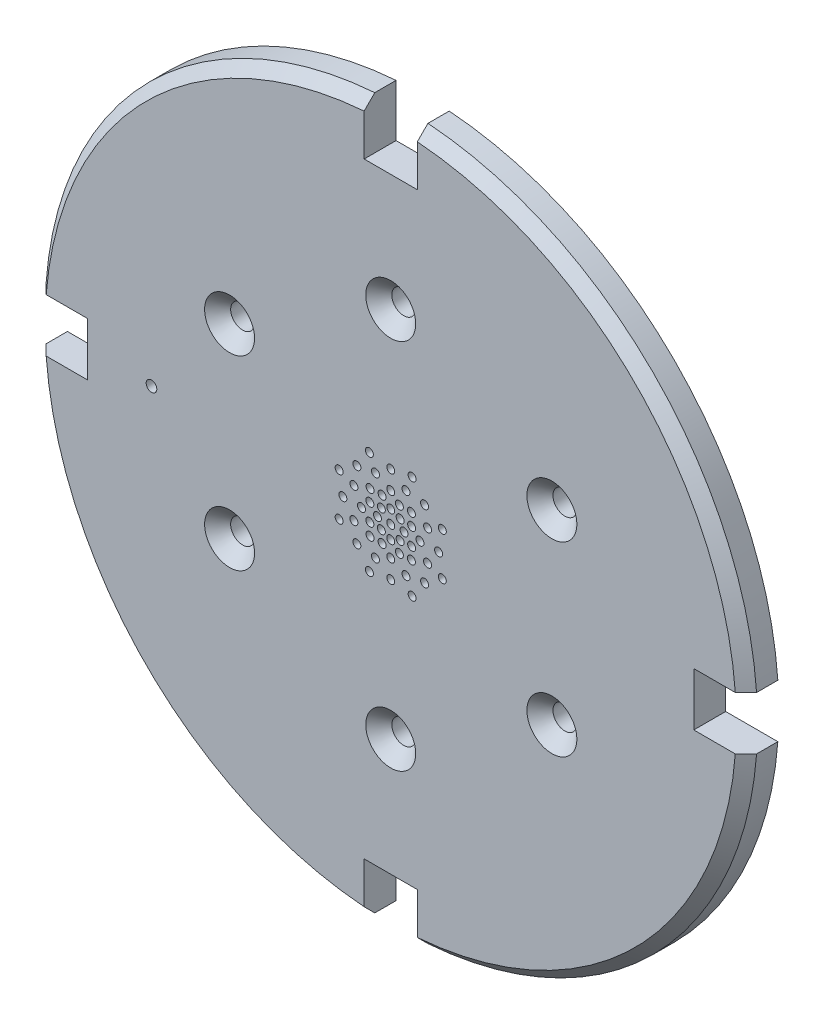
from build123d import *

# Parameters (mm, degrees)
SZKIC1_R                                             = 67
DODANIE_WYCI_GNI_CIE1_DEPTH                          = 6
SFAZOWANIE1_SIZE                                     = 2
OTWORY_USTALAJ_CE_1_5MM1_D                           = 1.5
OTWORY_USTALAJ_CE_1_5MM1_DEPTH                       = 6
OTWORY_USTALAJ_CE_1_5MM1_TIP                         = 0.450645464
OTWORY_USTALAJ_CE_1_5MM2_AT_2_COUNT                  = 2
OTWORY_USTALAJ_CE_1_5MM2_AT_2_PITCH                  = 2.163344618
OTWORY_USTALAJ_CE_1_5MM2_AT_3_COUNT                  = 2
OTWORY_USTALAJ_CE_1_5MM2_AT_3_PITCH                  = 3
OTWORY_USTALAJ_CE_1_5MM2_AT_4_COUNT                  = 2
OTWORY_USTALAJ_CE_1_5MM2_AT_4_PITCH                  = 5.277737918
OTWORY_USTALAJ_CE_1_5MM2_AT_5_COUNT                  = 2
OTWORY_USTALAJ_CE_1_5MM2_AT_5_PITCH                  = 6.5
OTWORY_USTALAJ_CE_1_5MM2_AT_6_COUNT                  = 2
OTWORY_USTALAJ_CE_1_5MM2_AT_6_PITCH                  = 8.245988391
SZYK_KO_OWY1_COUNT                                   = 8
WYTNIJ_WYCI_GNI_CIE1_REACH                           = 96.942
SZKIC7_R                                             = 2.05
SZYK_KO_OWY2_COUNT                                   = 6
SZKIC8_R                                             = 1
WYTNIJ_WYCI_GNI_CIE2_DEPTH                           = 20
SZKIC9_W                                             = 10
SZKIC9_H                                             = 10
WYTNIJ_WYCI_GNI_CIE3_DEPTH                           = 10
SZYK_KO_OWY3_COUNT                                   = 4
POG_BIENIE_STO_KOWE_POD_M4_WKR_T_DO_CZ_C_D           = 4.5
POG_BIENIE_STO_KOWE_POD_M4_WKR_T_DO_CZ_C_CSINK_D     = 9.4
POG_BIENIE_STO_KOWE_POD_M4_WKR_T_DO_CZ_C_CSINK_ANGLE = 90
SZYK_KO_OWY4_COUNT                                   = 6


with BuildPart() as part:
    # Szkic1 → Dodanie-wyciągnięcie1 (new body)
    with BuildSketch(Plane.XY):
        Circle(SZKIC1_R)
    extrude(amount=DODANIE_WYCI_GNI_CIE1_DEPTH)

    # Sfazowanie1
    sfazowanie1_edges = [part.edges().sort_by_distance(p)[0] for p in [
        (-67, 0, 6),
    ]]
    chamfer(sfazowanie1_edges, length=SFAZOWANIE1_SIZE)

    # Otwory ustalające Ø1.5mm1
    with Locations(Plane.XY.offset(6)):
        with Locations((0, 0)):
            Hole(OTWORY_USTALAJ_CE_1_5MM1_D / 2, depth=OTWORY_USTALAJ_CE_1_5MM1_DEPTH)
            with Locations((0, 0, -(OTWORY_USTALAJ_CE_1_5MM1_DEPTH + OTWORY_USTALAJ_CE_1_5MM1_TIP / 2))):  # 118° drill point
                Cone(0, OTWORY_USTALAJ_CE_1_5MM1_D / 2, OTWORY_USTALAJ_CE_1_5MM1_TIP, mode=Mode.SUBTRACT)

    # Szkic6 → Otwory ustalające Ø1.5mm2 (revolve, cut)
    with BuildSketch(Plane(origin=(0, 2.5, 6), x_dir=(0, -1, 0), z_dir=(1, 0, 0))):
        Polygon((0, 0), (0, 6.450645464), (0.75, 6), (0.75, 0), align=None)
    otwory_ustalaj_ce_1_5mm2 = revolve(axis=Axis((0, 2.5, 12.35), (0, 0, -1)), mode=Mode.SUBTRACT)

    # Otwory ustalające Ø1.5mm2 at 2: Otwory ustalające Ø1.5mm2 ×2
    with Locations(*[Vector(0.7518009726157915, 0.6593900951439519, 0) * (i * OTWORY_USTALAJ_CE_1_5MM2_AT_2_PITCH) for i in range(1, OTWORY_USTALAJ_CE_1_5MM2_AT_2_COUNT)]):
        add(otwory_ustalaj_ce_1_5mm2, mode=Mode.SUBTRACT)

    # Otwory ustalające Ø1.5mm2 at 3: Otwory ustalające Ø1.5mm2 ×2
    with Locations(*[(0, i * OTWORY_USTALAJ_CE_1_5MM2_AT_3_PITCH, 0) for i in range(1, OTWORY_USTALAJ_CE_1_5MM2_AT_3_COUNT)]):
        add(otwory_ustalaj_ce_1_5mm2, mode=Mode.SUBTRACT)

    # Otwory ustalające Ø1.5mm2 at 4: Otwory ustalające Ø1.5mm2 ×2
    with Locations(*[Vector(0.543817405741812, 0.839203568398184, 0) * (i * OTWORY_USTALAJ_CE_1_5MM2_AT_4_PITCH) for i in range(1, OTWORY_USTALAJ_CE_1_5MM2_AT_4_COUNT)]):
        add(otwory_ustalaj_ce_1_5mm2, mode=Mode.SUBTRACT)

    # Otwory ustalające Ø1.5mm2 at 5: Otwory ustalające Ø1.5mm2 ×2
    with Locations(*[(0, i * OTWORY_USTALAJ_CE_1_5MM2_AT_5_PITCH, 0) for i in range(1, OTWORY_USTALAJ_CE_1_5MM2_AT_5_COUNT)]):
        add(otwory_ustalaj_ce_1_5mm2, mode=Mode.SUBTRACT)

    # Otwory ustalające Ø1.5mm2 at 6: Otwory ustalające Ø1.5mm2 ×2
    with Locations(*[Vector(0.4872885880192179, 0.8732409930747852, 0) * (i * OTWORY_USTALAJ_CE_1_5MM2_AT_6_PITCH) for i in range(1, OTWORY_USTALAJ_CE_1_5MM2_AT_6_COUNT)]):
        add(otwory_ustalaj_ce_1_5mm2, mode=Mode.SUBTRACT)

    # Szyk kołowy1: Otwory ustalające Ø1.5mm2 ×8 about axis
    szyk_ko_owy1_axis = Axis((0, 0, 12.200873246), (0, 0, -1))
    for i in range(1, SZYK_KO_OWY1_COUNT):
        add(otwory_ustalaj_ce_1_5mm2.rotate(szyk_ko_owy1_axis, i * 360 / SZYK_KO_OWY1_COUNT), mode=Mode.SUBTRACT)

    # Szyk kołowy1 copy 1 sketch → Szyk kołowy1 copy 1 (revolve, cut)
    with BuildSketch(Plane(origin=(3.926488013, 1.626404588, 6), x_dir=(-0.7071067811865475, -0.7071067811865476, 0), z_dir=(0.7071067811865476, -0.7071067811865475, 0))):
        Polygon((0, 0), (0, 6.450645464), (0.75, 6), (0.75, 0), align=None)
    revolve(axis=Axis((3.926488013, 1.626404588, 12.35), (0, 0, -1)), mode=Mode.SUBTRACT)

    # Szyk kołowy1 copy 2 sketch → Szyk kołowy1 copy 2 (revolve, cut)
    with BuildSketch(Plane(origin=(3.926488013, -1.626404588, 6), x_dir=(-1, 0, 0), z_dir=(0, -1, 0))):
        Polygon((0, 0), (0, 6.450645464), (0.75, 6), (0.75, 0), align=None)
    revolve(axis=Axis((3.926488013, -1.626404588, 12.35), (0, 0, -1)), mode=Mode.SUBTRACT)

    # Szyk kołowy1 copy 3 sketch → Szyk kołowy1 copy 3 (revolve, cut)
    with BuildSketch(Plane(origin=(1.626404588, -3.926488013, 6), x_dir=(-0.7071067811865476, 0.7071067811865475, 0), z_dir=(-0.7071067811865475, -0.7071067811865476, 0))):
        Polygon((0, 0), (0, 6.450645464), (0.75, 6), (0.75, 0), align=None)
    revolve(axis=Axis((1.626404588, -3.926488013, 12.35), (0, 0, -1)), mode=Mode.SUBTRACT)

    # Szyk kołowy1 copy 4 sketch → Szyk kołowy1 copy 4 (revolve, cut)
    with BuildSketch(Plane(origin=(-1.626404588, -3.926488013, 6), x_dir=(0, 1, 0), z_dir=(-1, 0, 0))):
        Polygon((0, 0), (0, 6.450645464), (0.75, 6), (0.75, 0), align=None)
    revolve(axis=Axis((-1.626404588, -3.926488013, 12.35), (0, 0, -1)), mode=Mode.SUBTRACT)

    # Szyk kołowy1 copy 5 sketch → Szyk kołowy1 copy 5 (revolve, cut)
    with BuildSketch(Plane(origin=(-3.926488013, -1.626404588, 6), x_dir=(0.7071067811865475, 0.7071067811865477, 0), z_dir=(-0.7071067811865477, 0.7071067811865475, 0))):
        Polygon((0, 0), (0, 6.450645464), (0.75, 6), (0.75, 0), align=None)
    revolve(axis=Axis((-3.926488013, -1.626404588, 12.35), (0, 0, -1)), mode=Mode.SUBTRACT)

    # Szyk kołowy1 copy 6 sketch → Szyk kołowy1 copy 6 (revolve, cut)
    with BuildSketch(Plane(origin=(-3.926488013, 1.626404588, 6), x_dir=(1, 0, 0), z_dir=(0, 1, 0))):
        Polygon((0, 0), (0, 6.450645464), (0.75, 6), (0.75, 0), align=None)
    revolve(axis=Axis((-3.926488013, 1.626404588, 12.35), (0, 0, -1)), mode=Mode.SUBTRACT)

    # Szyk kołowy1 copy 7 sketch → Szyk kołowy1 copy 7 (revolve, cut)
    with BuildSketch(Plane(origin=(-1.626404588, 3.926488013, 6), x_dir=(0.7071067811865477, -0.7071067811865474, 0), z_dir=(0.7071067811865474, 0.7071067811865477, 0))):
        Polygon((0, 0), (0, 6.450645464), (0.75, 6), (0.75, 0), align=None)
    revolve(axis=Axis((-1.626404588, 3.926488013, 12.35), (0, 0, -1)), mode=Mode.SUBTRACT)

    # Szyk kołowy1 copy 8 sketch → Szyk kołowy1 copy 8 (revolve, cut)
    with BuildSketch(Plane(origin=(3.889087297, 3.889087297, 6), x_dir=(-0.7071067811865475, -0.7071067811865476, 0), z_dir=(0.7071067811865476, -0.7071067811865475, 0))):
        Polygon((0, 0), (0, 6.450645464), (0.75, 6), (0.75, 0), align=None)
    revolve(axis=Axis((3.889087297, 3.889087297, 12.35), (0, 0, -1)), mode=Mode.SUBTRACT)

    # Szyk kołowy1 copy 9 sketch → Szyk kołowy1 copy 9 (revolve, cut)
    with BuildSketch(Plane(origin=(5.5, 0, 6), x_dir=(-1, 0, 0), z_dir=(0, -1, 0))):
        Polygon((0, 0), (0, 6.450645464), (0.75, 6), (0.75, 0), align=None)
    revolve(axis=Axis((5.5, 0, 12.35), (0, 0, -1)), mode=Mode.SUBTRACT)

    # Szyk kołowy1 copy 10 sketch → Szyk kołowy1 copy 10 (revolve, cut)
    with BuildSketch(Plane(origin=(3.889087297, -3.889087297, 6), x_dir=(-0.7071067811865476, 0.7071067811865475, 0), z_dir=(-0.7071067811865475, -0.7071067811865476, 0))):
        Polygon((0, 0), (0, 6.450645464), (0.75, 6), (0.75, 0), align=None)
    revolve(axis=Axis((3.889087297, -3.889087297, 12.35), (0, 0, -1)), mode=Mode.SUBTRACT)

    # Szyk kołowy1 copy 11 sketch → Szyk kołowy1 copy 11 (revolve, cut)
    with BuildSketch(Plane(origin=(0, -5.5, 6), x_dir=(0, 1, 0), z_dir=(-1, 0, 0))):
        Polygon((0, 0), (0, 6.450645464), (0.75, 6), (0.75, 0), align=None)
    revolve(axis=Axis((0, -5.5, 12.35), (0, 0, -1)), mode=Mode.SUBTRACT)

    # Szyk kołowy1 copy 12 sketch → Szyk kołowy1 copy 12 (revolve, cut)
    with BuildSketch(Plane(origin=(-3.889087297, -3.889087297, 6), x_dir=(0.7071067811865475, 0.7071067811865477, 0), z_dir=(-0.7071067811865477, 0.7071067811865475, 0))):
        Polygon((0, 0), (0, 6.450645464), (0.75, 6), (0.75, 0), align=None)
    revolve(axis=Axis((-3.889087297, -3.889087297, 12.35), (0, 0, -1)), mode=Mode.SUBTRACT)

    # Szyk kołowy1 copy 13 sketch → Szyk kołowy1 copy 13 (revolve, cut)
    with BuildSketch(Plane(origin=(-5.5, 0, 6), x_dir=(1, 0, 0), z_dir=(0, 1, 0))):
        Polygon((0, 0), (0, 6.450645464), (0.75, 6), (0.75, 0), align=None)
    revolve(axis=Axis((-5.5, 0, 12.35), (0, 0, -1)), mode=Mode.SUBTRACT)

    # Szyk kołowy1 copy 14 sketch → Szyk kołowy1 copy 14 (revolve, cut)
    with BuildSketch(Plane(origin=(-3.889087297, 3.889087297, 6), x_dir=(0.7071067811865477, -0.7071067811865474, 0), z_dir=(0.7071067811865474, 0.7071067811865477, 0))):
        Polygon((0, 0), (0, 6.450645464), (0.75, 6), (0.75, 0), align=None)
    revolve(axis=Axis((-3.889087297, 3.889087297, 12.35), (0, 0, -1)), mode=Mode.SUBTRACT)

    # Szyk kołowy1 copy 15 sketch → Szyk kołowy1 copy 15 (revolve, cut)
    with BuildSketch(Plane(origin=(6.929096494, 2.870125743, 6), x_dir=(-0.7071067811865475, -0.7071067811865476, 0), z_dir=(0.7071067811865476, -0.7071067811865475, 0))):
        Polygon((0, 0), (0, 6.450645464), (0.75, 6), (0.75, 0), align=None)
    revolve(axis=Axis((6.929096494, 2.870125743, 12.35), (0, 0, -1)), mode=Mode.SUBTRACT)

    # Szyk kołowy1 copy 16 sketch → Szyk kołowy1 copy 16 (revolve, cut)
    with BuildSketch(Plane(origin=(6.929096494, -2.870125743, 6), x_dir=(-1, 0, 0), z_dir=(0, -1, 0))):
        Polygon((0, 0), (0, 6.450645464), (0.75, 6), (0.75, 0), align=None)
    revolve(axis=Axis((6.929096494, -2.870125743, 12.35), (0, 0, -1)), mode=Mode.SUBTRACT)

    # Szyk kołowy1 copy 17 sketch → Szyk kołowy1 copy 17 (revolve, cut)
    with BuildSketch(Plane(origin=(2.870125743, -6.929096494, 6), x_dir=(-0.7071067811865476, 0.7071067811865475, 0), z_dir=(-0.7071067811865475, -0.7071067811865476, 0))):
        Polygon((0, 0), (0, 6.450645464), (0.75, 6), (0.75, 0), align=None)
    revolve(axis=Axis((2.870125743, -6.929096494, 12.35), (0, 0, -1)), mode=Mode.SUBTRACT)

    # Szyk kołowy1 copy 18 sketch → Szyk kołowy1 copy 18 (revolve, cut)
    with BuildSketch(Plane(origin=(-2.870125743, -6.929096494, 6), x_dir=(0, 1, 0), z_dir=(-1, 0, 0))):
        Polygon((0, 0), (0, 6.450645464), (0.75, 6), (0.75, 0), align=None)
    revolve(axis=Axis((-2.870125743, -6.929096494, 12.35), (0, 0, -1)), mode=Mode.SUBTRACT)

    # Szyk kołowy1 copy 19 sketch → Szyk kołowy1 copy 19 (revolve, cut)
    with BuildSketch(Plane(origin=(-6.929096494, -2.870125743, 6), x_dir=(0.7071067811865475, 0.7071067811865477, 0), z_dir=(-0.7071067811865477, 0.7071067811865475, 0))):
        Polygon((0, 0), (0, 6.450645464), (0.75, 6), (0.75, 0), align=None)
    revolve(axis=Axis((-6.929096494, -2.870125743, 12.35), (0, 0, -1)), mode=Mode.SUBTRACT)

    # Szyk kołowy1 copy 20 sketch → Szyk kołowy1 copy 20 (revolve, cut)
    with BuildSketch(Plane(origin=(-6.929096494, 2.870125743, 6), x_dir=(1, 0, 0), z_dir=(0, 1, 0))):
        Polygon((0, 0), (0, 6.450645464), (0.75, 6), (0.75, 0), align=None)
    revolve(axis=Axis((-6.929096494, 2.870125743, 12.35), (0, 0, -1)), mode=Mode.SUBTRACT)

    # Szyk kołowy1 copy 21 sketch → Szyk kołowy1 copy 21 (revolve, cut)
    with BuildSketch(Plane(origin=(-2.870125743, 6.929096494, 6), x_dir=(0.7071067811865477, -0.7071067811865474, 0), z_dir=(0.7071067811865474, 0.7071067811865477, 0))):
        Polygon((0, 0), (0, 6.450645464), (0.75, 6), (0.75, 0), align=None)
    revolve(axis=Axis((-2.870125743, 6.929096494, 12.35), (0, 0, -1)), mode=Mode.SUBTRACT)

    # Szyk kołowy1 copy 22 sketch → Szyk kołowy1 copy 22 (revolve, cut)
    with BuildSketch(Plane(origin=(6.363961031, 6.363961031, 6), x_dir=(-0.7071067811865475, -0.7071067811865476, 0), z_dir=(0.7071067811865476, -0.7071067811865475, 0))):
        Polygon((0, 0), (0, 6.450645464), (0.75, 6), (0.75, 0), align=None)
    revolve(axis=Axis((6.363961031, 6.363961031, 12.35), (0, 0, -1)), mode=Mode.SUBTRACT)

    # Szyk kołowy1 copy 23 sketch → Szyk kołowy1 copy 23 (revolve, cut)
    with BuildSketch(Plane(origin=(9, 0, 6), x_dir=(-1, 0, 0), z_dir=(0, -1, 0))):
        Polygon((0, 0), (0, 6.450645464), (0.75, 6), (0.75, 0), align=None)
    revolve(axis=Axis((9, 0, 12.35), (0, 0, -1)), mode=Mode.SUBTRACT)

    # Szyk kołowy1 copy 24 sketch → Szyk kołowy1 copy 24 (revolve, cut)
    with BuildSketch(Plane(origin=(6.363961031, -6.363961031, 6), x_dir=(-0.7071067811865476, 0.7071067811865475, 0), z_dir=(-0.7071067811865475, -0.7071067811865476, 0))):
        Polygon((0, 0), (0, 6.450645464), (0.75, 6), (0.75, 0), align=None)
    revolve(axis=Axis((6.363961031, -6.363961031, 12.35), (0, 0, -1)), mode=Mode.SUBTRACT)

    # Szyk kołowy1 copy 25 sketch → Szyk kołowy1 copy 25 (revolve, cut)
    with BuildSketch(Plane(origin=(0, -9, 6), x_dir=(0, 1, 0), z_dir=(-1, 0, 0))):
        Polygon((0, 0), (0, 6.450645464), (0.75, 6), (0.75, 0), align=None)
    revolve(axis=Axis((0, -9, 12.35), (0, 0, -1)), mode=Mode.SUBTRACT)

    # Szyk kołowy1 copy 26 sketch → Szyk kołowy1 copy 26 (revolve, cut)
    with BuildSketch(Plane(origin=(-6.363961031, -6.363961031, 6), x_dir=(0.7071067811865475, 0.7071067811865477, 0), z_dir=(-0.7071067811865477, 0.7071067811865475, 0))):
        Polygon((0, 0), (0, 6.450645464), (0.75, 6), (0.75, 0), align=None)
    revolve(axis=Axis((-6.363961031, -6.363961031, 12.35), (0, 0, -1)), mode=Mode.SUBTRACT)

    # Szyk kołowy1 copy 27 sketch → Szyk kołowy1 copy 27 (revolve, cut)
    with BuildSketch(Plane(origin=(-9, 0, 6), x_dir=(1, 0, 0), z_dir=(0, 1, 0))):
        Polygon((0, 0), (0, 6.450645464), (0.75, 6), (0.75, 0), align=None)
    revolve(axis=Axis((-9, 0, 12.35), (0, 0, -1)), mode=Mode.SUBTRACT)

    # Szyk kołowy1 copy 28 sketch → Szyk kołowy1 copy 28 (revolve, cut)
    with BuildSketch(Plane(origin=(-6.363961031, 6.363961031, 6), x_dir=(0.7071067811865477, -0.7071067811865474, 0), z_dir=(0.7071067811865474, 0.7071067811865477, 0))):
        Polygon((0, 0), (0, 6.450645464), (0.75, 6), (0.75, 0), align=None)
    revolve(axis=Axis((-6.363961031, 6.363961031, 12.35), (0, 0, -1)), mode=Mode.SUBTRACT)

    # Szyk kołowy1 copy 29 sketch → Szyk kołowy1 copy 29 (revolve, cut)
    with BuildSketch(Plane(origin=(9.700735091, 4.01817604, 6), x_dir=(-0.7071067811865475, -0.7071067811865476, 0), z_dir=(0.7071067811865476, -0.7071067811865475, 0))):
        Polygon((0, 0), (0, 6.450645464), (0.75, 6), (0.75, 0), align=None)
    revolve(axis=Axis((9.700735091, 4.01817604, 12.35), (0, 0, -1)), mode=Mode.SUBTRACT)

    # Szyk kołowy1 copy 30 sketch → Szyk kołowy1 copy 30 (revolve, cut)
    with BuildSketch(Plane(origin=(9.700735091, -4.01817604, 6), x_dir=(-1, 0, 0), z_dir=(0, -1, 0))):
        Polygon((0, 0), (0, 6.450645464), (0.75, 6), (0.75, 0), align=None)
    revolve(axis=Axis((9.700735091, -4.01817604, 12.35), (0, 0, -1)), mode=Mode.SUBTRACT)

    # Szyk kołowy1 copy 31 sketch → Szyk kołowy1 copy 31 (revolve, cut)
    with BuildSketch(Plane(origin=(4.01817604, -9.700735091, 6), x_dir=(-0.7071067811865476, 0.7071067811865475, 0), z_dir=(-0.7071067811865475, -0.7071067811865476, 0))):
        Polygon((0, 0), (0, 6.450645464), (0.75, 6), (0.75, 0), align=None)
    revolve(axis=Axis((4.01817604, -9.700735091, 12.35), (0, 0, -1)), mode=Mode.SUBTRACT)

    # Szyk kołowy1 copy 32 sketch → Szyk kołowy1 copy 32 (revolve, cut)
    with BuildSketch(Plane(origin=(-4.01817604, -9.700735091, 6), x_dir=(0, 1, 0), z_dir=(-1, 0, 0))):
        Polygon((0, 0), (0, 6.450645464), (0.75, 6), (0.75, 0), align=None)
    revolve(axis=Axis((-4.01817604, -9.700735091, 12.35), (0, 0, -1)), mode=Mode.SUBTRACT)

    # Szyk kołowy1 copy 33 sketch → Szyk kołowy1 copy 33 (revolve, cut)
    with BuildSketch(Plane(origin=(-9.700735091, -4.01817604, 6), x_dir=(0.7071067811865475, 0.7071067811865477, 0), z_dir=(-0.7071067811865477, 0.7071067811865475, 0))):
        Polygon((0, 0), (0, 6.450645464), (0.75, 6), (0.75, 0), align=None)
    revolve(axis=Axis((-9.700735091, -4.01817604, 12.35), (0, 0, -1)), mode=Mode.SUBTRACT)

    # Szyk kołowy1 copy 34 sketch → Szyk kołowy1 copy 34 (revolve, cut)
    with BuildSketch(Plane(origin=(-9.700735091, 4.01817604, 6), x_dir=(1, 0, 0), z_dir=(0, 1, 0))):
        Polygon((0, 0), (0, 6.450645464), (0.75, 6), (0.75, 0), align=None)
    revolve(axis=Axis((-9.700735091, 4.01817604, 12.35), (0, 0, -1)), mode=Mode.SUBTRACT)

    # Szyk kołowy1 copy 35 sketch → Szyk kołowy1 copy 35 (revolve, cut)
    with BuildSketch(Plane(origin=(-4.01817604, 9.700735091, 6), x_dir=(0.7071067811865477, -0.7071067811865474, 0), z_dir=(0.7071067811865474, 0.7071067811865477, 0))):
        Polygon((0, 0), (0, 6.450645464), (0.75, 6), (0.75, 0), align=None)
    revolve(axis=Axis((-4.01817604, 9.700735091, 12.35), (0, 0, -1)), mode=Mode.SUBTRACT)

    # Szkic7 → Wytnij-wyciągnięcie1 (cut, up to next)
    with BuildSketch(Plane.XY.offset(6), mode=Mode.PRIVATE) as wytnij_wyci_gni_cie1_sk1:
        with Locations((0, 35)):
            Circle(SZKIC7_R)
    wytnij_wyci_gni_cie1_tool1 = extrude(wytnij_wyci_gni_cie1_sk1.sketch, amount=-WYTNIJ_WYCI_GNI_CIE1_REACH, mode=Mode.PRIVATE) & part.part
    wytnij_wyci_gni_cie1 = wytnij_wyci_gni_cie1_tool1.solids().sort_by_distance((0, 35, 6))[0]
    add(wytnij_wyci_gni_cie1, mode=Mode.SUBTRACT)

    # Szyk kołowy2: Wytnij-wyciągnięcie1 ×6 about axis
    szyk_ko_owy2_axis = Axis((0, 0, 12.200873246), (0, 0, -1))
    for i in range(1, SZYK_KO_OWY2_COUNT):
        add(wytnij_wyci_gni_cie1.rotate(szyk_ko_owy2_axis, i * 360 / SZYK_KO_OWY2_COUNT), mode=Mode.SUBTRACT)

    # Szkic8 → Wytnij-wyciągnięcie2 (cut, symmetric)
    with BuildSketch(Plane.XY.offset(6)):
        with Locations((-45, 0)):
            Circle(SZKIC8_R)
    extrude(amount=WYTNIJ_WYCI_GNI_CIE2_DEPTH, both=True, mode=Mode.SUBTRACT)

    # Szkic9 → Wytnij-wyciągnięcie3 (cut)
    with BuildSketch(Plane.XY.offset(6)):
        with Locations((62, 0)):
            Rectangle(SZKIC9_W, SZKIC9_H)
    wytnij_wyci_gni_cie3 = extrude(amount=-WYTNIJ_WYCI_GNI_CIE3_DEPTH, mode=Mode.SUBTRACT)

    # Szyk kołowy3: Wytnij-wyciągnięcie3 ×4 about axis
    szyk_ko_owy3_axis = Axis((0, 0, 6), (0, 0, 1))
    for i in range(1, SZYK_KO_OWY3_COUNT):
        add(wytnij_wyci_gni_cie3.rotate(szyk_ko_owy3_axis, i * 360 / SZYK_KO_OWY3_COUNT), mode=Mode.SUBTRACT)

    # Pogłębienie stożkowe pod M4 wkręt do części metalowych z łbem soczewkowym1 (through all)
    with Locations(Plane(origin=(0, 35, 6), x_dir=(1, 0, 0), z_dir=(0, 0, 1))):
        with Locations((0, 0)):
            pog_bienie_sto_kowe_pod_m4_wkr_t_do_cz_c = CounterSinkHole(POG_BIENIE_STO_KOWE_POD_M4_WKR_T_DO_CZ_C_D / 2, POG_BIENIE_STO_KOWE_POD_M4_WKR_T_DO_CZ_C_CSINK_D / 2, counter_sink_angle=POG_BIENIE_STO_KOWE_POD_M4_WKR_T_DO_CZ_C_CSINK_ANGLE)

    # Szyk kołowy4: Pogłębienie stożkowe pod M4 wkręt do części metalowych z łbem soczewkowym1 ×6 about axis
    szyk_ko_owy4_axis = Axis((0, 0, 12.200873246), (0, 0, -1))
    for i in range(1, SZYK_KO_OWY4_COUNT):
        add(pog_bienie_sto_kowe_pod_m4_wkr_t_do_cz_c.rotate(szyk_ko_owy4_axis, i * 360 / SZYK_KO_OWY4_COUNT), mode=Mode.SUBTRACT)


solid = part.part
